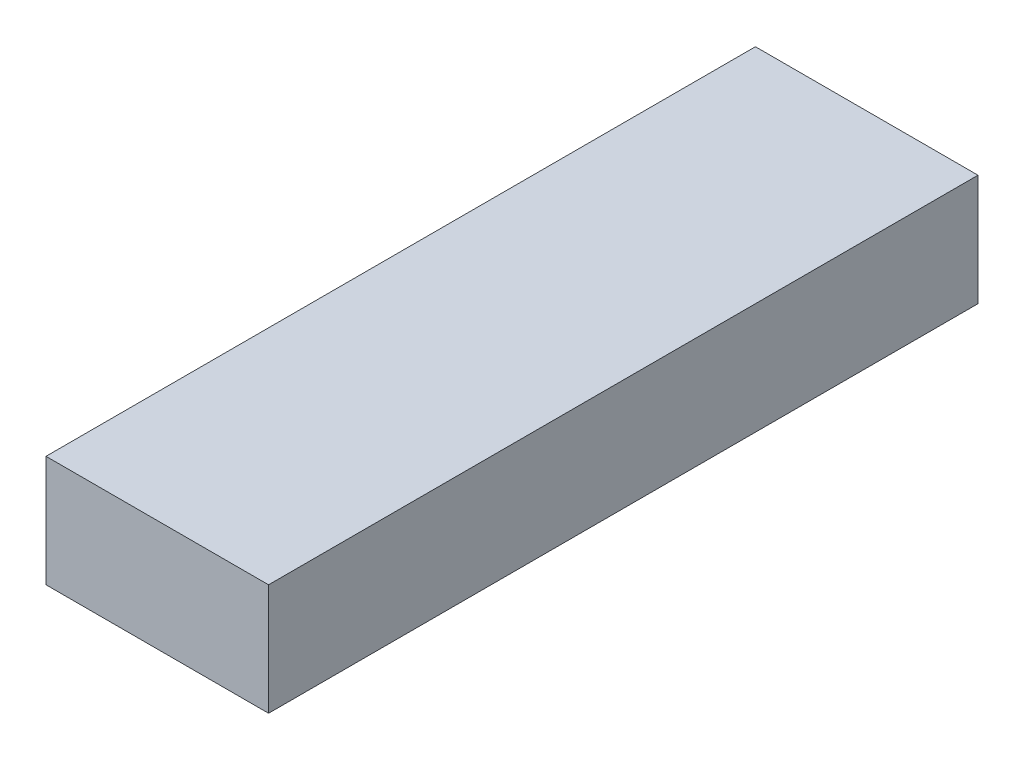
from build123d import *

# Parameters (mm, degrees)
SKETCH1_W           = 31.999936
SKETCH1_H           = 15.999968
BOSS_EXTRUDE1_DEPTH = 50.999898


with BuildPart() as part:
    # Sketch1 → Boss-Extrude1 (new, symmetric)
    with BuildSketch(Plane.XY):
        Rectangle(SKETCH1_W, SKETCH1_H)
    extrude(amount=BOSS_EXTRUDE1_DEPTH, both=True)


solid = part.part
